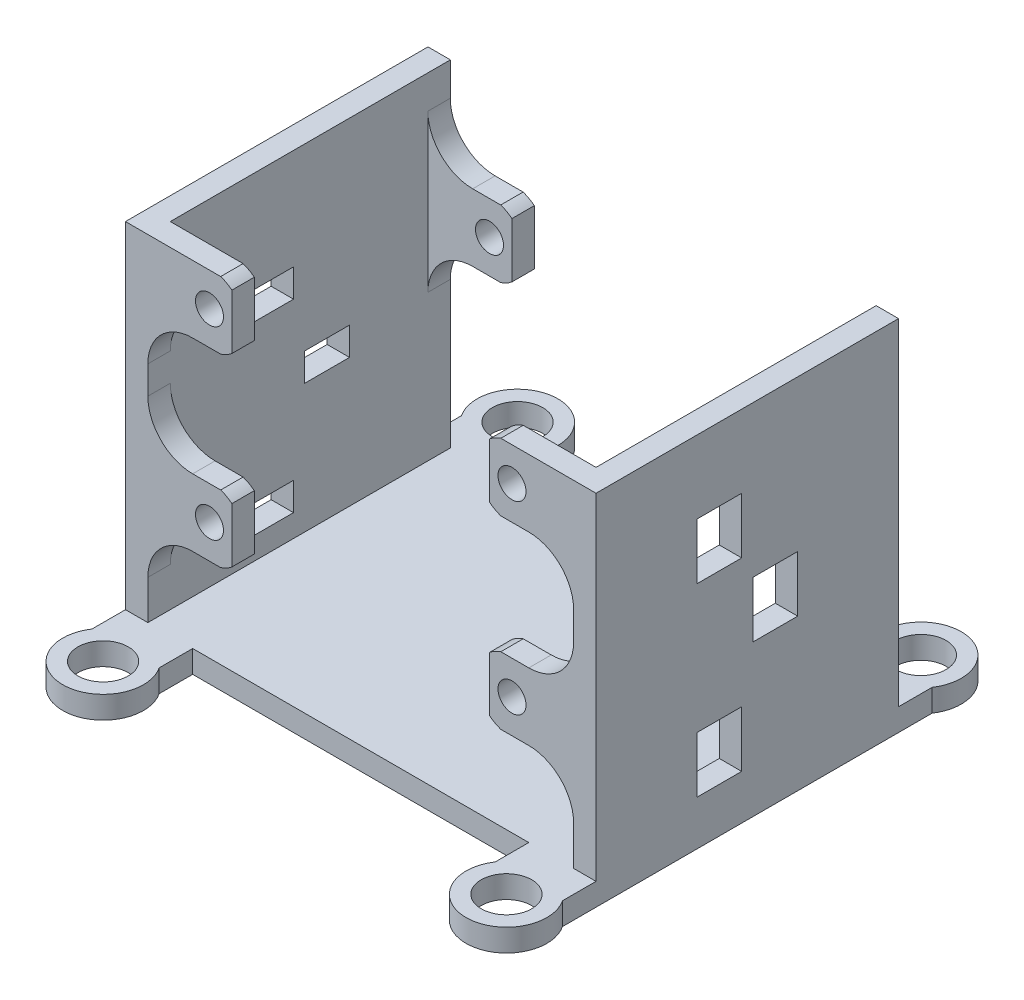
from build123d import *

# Parameters (mm, degrees)
SKETCH_1_W                       = 42
SKETCH_1_H                       = 27
EXTRUDE_1_DEPTH                  = 2
SKETCH_2_W                       = 27
SKETCH_2_H                       = 30
SKETCH_2_W_2                     = 4
SKETCH_2_H_2                     = 5
EXTRUDE_2_DEPTH                  = 2
SKETCH_3_W                       = 4
SKETCH_3_H                       = 2.5
EXTRUDE_3_DEPTH                  = 2
SKETCH_4_R                       = 1.25
EXTRUDE_4_DEPTH                  = 2
PATTERN_LINEAR_1_COPY_1_SKETCH_R = 1.25
PATTERN_LINEAR_1_COPY_1_DEPTH    = 2
PATTERN_LINEAR_1_COPY_2_SKETCH_R = 1.25
PATTERN_LINEAR_1_COPY_2_DEPTH    = 2
PATTERN_LINEAR_2_COPY_1_SKETCH_R = 1.25
PATTERN_LINEAR_2_COPY_1_DEPTH    = 2
PATTERN_LINEAR_2_COPY_2_SKETCH_R = 1.25
PATTERN_LINEAR_2_COPY_2_DEPTH    = 2
FILLET_1_R                       = 4
SKETCH_8_R                       = 2.25
EXTRUDE_5_DEPTH                  = 2
MIRROR_4_COPY_1_SKETCH_R         = 2.25
MIRROR_4_COPY_1_DEPTH            = 2
MIRROR_4_COPY_2_SKETCH_R         = 2.25
MIRROR_4_COPY_2_DEPTH            = 2


with BuildPart() as part:
    # Эскиз1 → Бобышка-Вытянуть1 (new body)
    with BuildSketch(Plane(origin=(0, 0, 0), x_dir=(1, 0, 0), z_dir=(0, 1, 0))):
        Rectangle(SKETCH_1_W, SKETCH_1_H)
    extrude(amount=EXTRUDE_1_DEPTH)

    # Эскиз2 → Бобышка-Вытянуть2 (add)
    with BuildSketch(Plane(origin=(21, 0, 0), x_dir=(0, 0, -1), z_dir=(1, 0, 0))):
        with Locations((0, 17)):
            Rectangle(SKETCH_2_W, SKETCH_2_H)
        with Locations((-2.5, 6.5)):
            Rectangle(SKETCH_2_W_2, SKETCH_2_H_2, mode=Mode.SUBTRACT)
        with Locations((2.5, 16)):
            Rectangle(SKETCH_2_W_2, SKETCH_2_H_2, mode=Mode.SUBTRACT)
        with Locations((-2.5, 23)):
            Rectangle(SKETCH_2_W_2, SKETCH_2_H_2, mode=Mode.SUBTRACT)
    extrude_2 = extrude(amount=-EXTRUDE_2_DEPTH)

    # Зеркальное отражение1: Бобышка-Вытянуть2 across plane
    add(extrude_2.mirror(Plane(origin=(0, 0, 0), x_dir=(0, 0, 1), z_dir=(1, 0, 0))))

    # Эскиз3 → Бобышка-Вытянуть3 (add)
    with BuildSketch(Plane.ZY.offset(21)):
        with Locations((2.5, 24.25)):
            Rectangle(SKETCH_3_W, SKETCH_3_H)
        with Locations((-2.5, 17.25)):
            Rectangle(SKETCH_3_W, SKETCH_3_H)
        with Locations((2.5, 7.75)):
            Rectangle(SKETCH_3_W, SKETCH_3_H)
    extrude(amount=-EXTRUDE_3_DEPTH)

    # Эскиз4 → Бобышка-Вытянуть4 (add)
    with BuildSketch(Plane(origin=(0, 0, 13.5), x_dir=(-1, 0, 0), z_dir=(0, 0, -1))):
        with BuildLine():
            Line((-19, 9.5), (-19, 15.5))
            Line((-19, 15.5), (-12.5, 15.5))
            ThreePointArc((-12.5, 15.5), (-11.974953973, 15.270240895), (-11.5, 14.949489743))
            Line((-11.5, 14.949489743), (-11.5, 10.050510257))
            ThreePointArc((-11.5, 10.050510257), (-11.974953973, 9.729759105), (-12.5, 9.5))
            Line((-12.5, 9.5), (-19, 9.5))
        make_face()
        with Locations((-13.5, 12.5)):
            Circle(SKETCH_4_R, mode=Mode.SUBTRACT)
    extrude_4 = extrude(amount=EXTRUDE_4_DEPTH)

    # Зеркальное отражение2: Бобышка-Вытянуть4 across plane
    add(extrude_4.mirror(Plane(origin=(0, 0, 0), x_dir=(0, 0, 1), z_dir=(1, 0, 0))))

    # Линейный массив1 copy 1 sketch → Линейный массив1 copy 1 (add)
    with BuildSketch(Plane(origin=(0, 16.5, 13.5), x_dir=(1, 0, 0), z_dir=(0, 0, -1))):
        with BuildLine():
            Line((-19, -9.5), (-19, -15.5))
            Line((-19, -15.5), (-12.5, -15.5))
            ThreePointArc((-12.5, -15.5), (-11.974953973, -15.270240895), (-11.5, -14.949489743))
            Line((-11.5, -14.949489743), (-11.5, -10.050510257))
            ThreePointArc((-11.5, -10.050510257), (-11.974953973, -9.729759105), (-12.5, -9.5))
            Line((-12.5, -9.5), (-19, -9.5))
        make_face()
        with Locations((-13.5, -12.5)):
            Circle(PATTERN_LINEAR_1_COPY_1_SKETCH_R, mode=Mode.SUBTRACT)
    extrude(amount=PATTERN_LINEAR_1_COPY_1_DEPTH)

    # Линейный массив1 copy 2 sketch → Линейный массив1 copy 2 (add)
    with BuildSketch(Plane(origin=(0, 16.5, 13.5), x_dir=(-1, 0, 0), z_dir=(0, 0, -1))):
        with BuildLine():
            Line((-19, 9.5), (-19, 15.5))
            Line((-19, 15.5), (-12.5, 15.5))
            ThreePointArc((-12.5, 15.5), (-11.974953973, 15.270240895), (-11.5, 14.949489743))
            Line((-11.5, 14.949489743), (-11.5, 10.050510257))
            ThreePointArc((-11.5, 10.050510257), (-11.974953973, 9.729759105), (-12.5, 9.5))
            Line((-12.5, 9.5), (-19, 9.5))
        make_face()
        with Locations((-13.5, 12.5)):
            Circle(PATTERN_LINEAR_1_COPY_2_SKETCH_R, mode=Mode.SUBTRACT)
    extrude(amount=PATTERN_LINEAR_1_COPY_2_DEPTH)

    # Линейный массив2 copy 1 sketch → Линейный массив2 copy 1 (add)
    with BuildSketch(Plane(origin=(0, 9.534421985, -11.493145009), x_dir=(1, 0, 0), z_dir=(0, 0, -1))):
        with BuildLine():
            Line((-19, -9.5), (-19, -15.5))
            Line((-19, -15.5), (-12.5, -15.5))
            ThreePointArc((-12.5, -15.5), (-11.974953973, -15.270240895), (-11.5, -14.949489743))
            Line((-11.5, -14.949489743), (-11.5, -10.050510257))
            ThreePointArc((-11.5, -10.050510257), (-11.974953973, -9.729759105), (-12.5, -9.5))
            Line((-12.5, -9.5), (-19, -9.5))
        make_face()
        with Locations((-13.5, -12.5)):
            Circle(PATTERN_LINEAR_2_COPY_1_SKETCH_R, mode=Mode.SUBTRACT)
    extrude(amount=PATTERN_LINEAR_2_COPY_1_DEPTH)

    # Линейный массив2 copy 2 sketch → Линейный массив2 copy 2 (add)
    with BuildSketch(Plane(origin=(0, 9.534421985, -11.493145009), x_dir=(-1, 0, 0), z_dir=(0, 0, -1))):
        with BuildLine():
            Line((-19, 9.5), (-19, 15.5))
            Line((-19, 15.5), (-12.5, 15.5))
            ThreePointArc((-12.5, 15.5), (-11.974953973, 15.270240895), (-11.5, 14.949489743))
            Line((-11.5, 14.949489743), (-11.5, 10.050510257))
            ThreePointArc((-11.5, 10.050510257), (-11.974953973, 9.729759105), (-12.5, 9.5))
            Line((-12.5, 9.5), (-19, 9.5))
        make_face()
        with Locations((-13.5, 12.5)):
            Circle(PATTERN_LINEAR_2_COPY_2_SKETCH_R, mode=Mode.SUBTRACT)
    extrude(amount=PATTERN_LINEAR_2_COPY_2_DEPTH)

    # Скругление1
    fillet_1_edges = [part.edges().sort_by_distance(p)[0] for p in [
        (19, 15.5, 12.5),
        (19, 9.5, 12.5),
        (-19, 9.5, 12.5),
        (-19, 15.5, 12.5),
        (19, 26, 12.5),
        (-19, 26, 12.5),
        (-19, 19.034421985, -12.493145009),
        (-19, 25.034421985, -12.493145009),
        (19, 25.034421985, -12.493145009),
        (19, 19.034421985, -12.493145009),
    ]]
    fillet(fillet_1_edges, radius=FILLET_1_R)

    # Эскиз8 → Бобышка-Вытянуть5 (add)
    with BuildSketch(Plane(origin=(0, 0, 0), x_dir=(1, 0, 0), z_dir=(0, 1, 0))):
        with BuildLine():
            Line((-21, 13.5), (-18, 13.493145009))
            Line((-18, 13.493145009), (-15, 13.5))
            Line((-15, 13.5), (-15, 16.493145009))
            ThreePointArc((-15, 16.493145009), (-18, 22.098696284), (-21, 16.493145009))
            Line((-21, 16.493145009), (-21, 13.5))
        make_face()
        with Locations((-18, 18.493145009)):
            Circle(SKETCH_8_R, mode=Mode.SUBTRACT)
    extrude_5 = extrude(amount=EXTRUDE_5_DEPTH)

    # Зеркальное отражение3: Бобышка-Вытянуть5 across plane
    add(extrude_5.mirror(Plane(origin=(0, 0, 0), x_dir=(0, 0, 1), z_dir=(1, 0, 0))))

    # Зеркальное отражение4 copy 1 sketch → Зеркальное отражение4 copy 1 (add)
    with BuildSketch(Plane(origin=(0, 0, 0), x_dir=(-1, 0, 0), z_dir=(0, 1, 0))):
        with BuildLine():
            Line((-21, 13.5), (-18, 13.493145009))
            Line((-18, 13.493145009), (-15, 13.5))
            Line((-15, 13.5), (-15, 16.493145009))
            ThreePointArc((-15, 16.493145009), (-18, 22.098696284), (-21, 16.493145009))
            Line((-21, 16.493145009), (-21, 13.5))
        make_face()
        with Locations((-18, 18.493145009)):
            Circle(MIRROR_4_COPY_1_SKETCH_R, mode=Mode.SUBTRACT)
    extrude(amount=MIRROR_4_COPY_1_DEPTH)

    # Зеркальное отражение4 copy 2 sketch → Зеркальное отражение4 copy 2 (add)
    with BuildSketch(Plane(origin=(0, 0, 0), x_dir=(1, 0, 0), z_dir=(0, 1, 0))):
        with BuildLine():
            Line((-21, -13.5), (-18, -13.493145009))
            Line((-18, -13.493145009), (-15, -13.5))
            Line((-15, -13.5), (-15, -16.493145009))
            ThreePointArc((-15, -16.493145009), (-18, -22.098696284), (-21, -16.493145009))
            Line((-21, -16.493145009), (-21, -13.5))
        make_face()
        with Locations((-18, -18.493145009)):
            Circle(MIRROR_4_COPY_2_SKETCH_R, mode=Mode.SUBTRACT)
    extrude(amount=MIRROR_4_COPY_2_DEPTH)


solid = part.part
